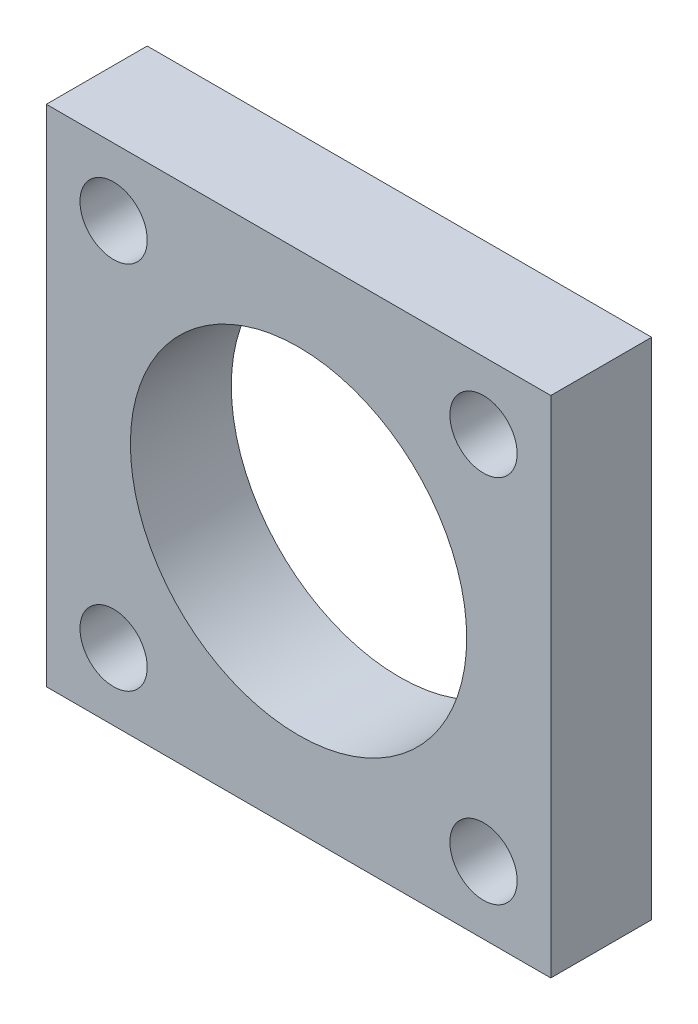
from build123d import *

# Parameters (mm, degrees)
SKETCH1_W           = 30
SKETCH1_H           = 30
SKETCH1_R           = 2
SKETCH1_R_2         = 10
BOSS_EXTRUDE1_DEPTH = 6


with BuildPart() as part:
    # Sketch1 → Boss-Extrude1 (new body)
    with BuildSketch(Plane.XY):
        Rectangle(SKETCH1_W, SKETCH1_H)
        with Locations((-11, -11)):
            Circle(SKETCH1_R, mode=Mode.SUBTRACT)
        with Locations((11, -11)):
            Circle(SKETCH1_R, mode=Mode.SUBTRACT)
        Circle(SKETCH1_R_2, mode=Mode.SUBTRACT)
        with Locations((-11, 11)):
            Circle(SKETCH1_R, mode=Mode.SUBTRACT)
        with Locations((11, 11)):
            Circle(SKETCH1_R, mode=Mode.SUBTRACT)
    extrude(amount=BOSS_EXTRUDE1_DEPTH)


solid = part.part
